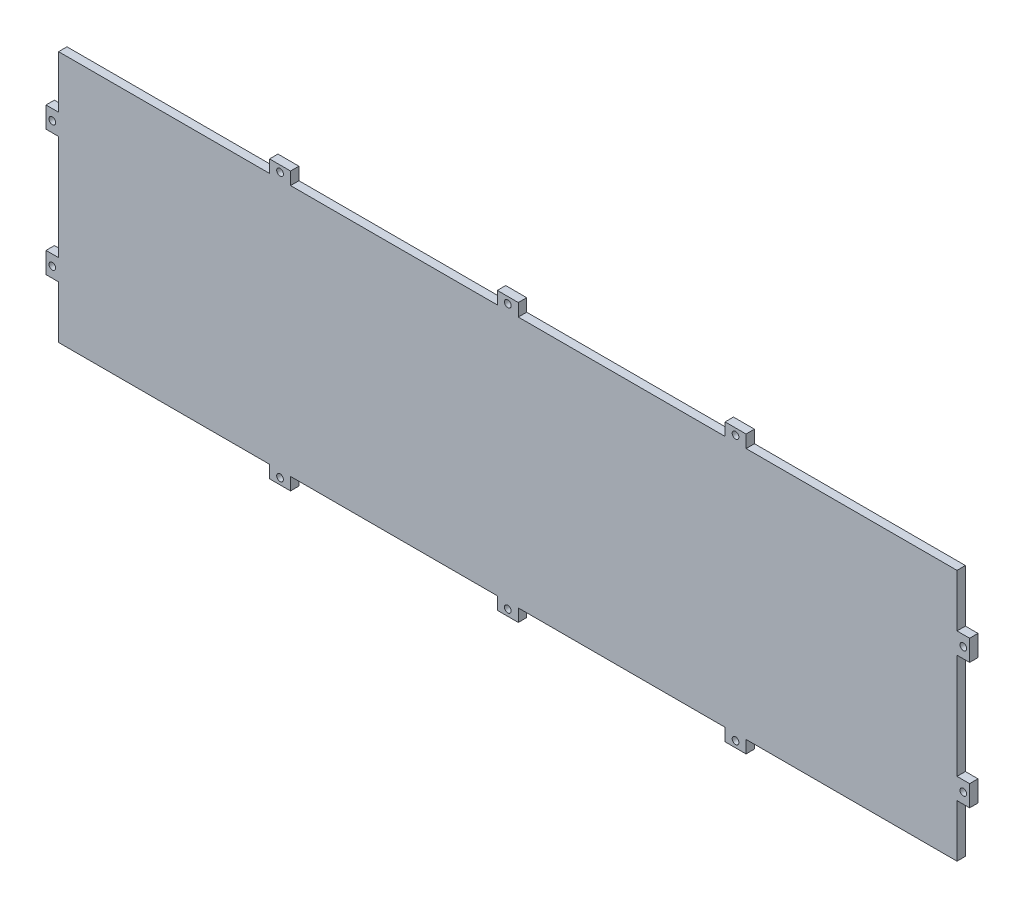
from build123d import *

# Parameters (mm, degrees)
SKETCH1_R           = 1.6
BOSS_EXTRUDE1_DEPTH = 4


with BuildPart() as part:
    # Sketch1 → Boss-Extrude1 (new body)
    with BuildSketch(Plane.XY):
        Polygon((6, 250), (106.5, 250), (106.5, 256), (116.5, 256), (116.5, 250), (215, 250), (215, 256), (225, 256), (225, 250), (323.5, 250), (323.5, 256), (333.5, 256), (333.5, 250), (434, 250), (434, 225), (440, 225), (440, 215), (434, 215), (434, 165), (440, 165), (440, 155), (434, 155), (434, 130), (333.5, 130), (333.5, 124), (323.5, 124), (323.5, 130), (225, 130), (225, 124), (215, 124), (215, 130), (116.5, 130), (116.5, 124), (106.5, 124), (106.5, 130), (6, 130), (6, 155), (0, 155), (0, 165), (6, 165), (6, 215), (0, 215), (0, 225), (6, 225), align=None)
        with Locations((111.5, 127)):
            Circle(SKETCH1_R, mode=Mode.SUBTRACT)
        with Locations((220, 127)):
            Circle(SKETCH1_R, mode=Mode.SUBTRACT)
        with Locations((328.5, 127)):
            Circle(SKETCH1_R, mode=Mode.SUBTRACT)
        with Locations((328.5, 253)):
            Circle(SKETCH1_R, mode=Mode.SUBTRACT)
        with Locations((220, 253)):
            Circle(SKETCH1_R, mode=Mode.SUBTRACT)
        with Locations((111.5, 253)):
            Circle(SKETCH1_R, mode=Mode.SUBTRACT)
        with Locations((3, 220)):
            Circle(SKETCH1_R, mode=Mode.SUBTRACT)
        with Locations((3, 160)):
            Circle(SKETCH1_R, mode=Mode.SUBTRACT)
        with Locations((437, 220)):
            Circle(SKETCH1_R, mode=Mode.SUBTRACT)
        with Locations((437, 160)):
            Circle(SKETCH1_R, mode=Mode.SUBTRACT)
    extrude(amount=-BOSS_EXTRUDE1_DEPTH)


solid = part.part
